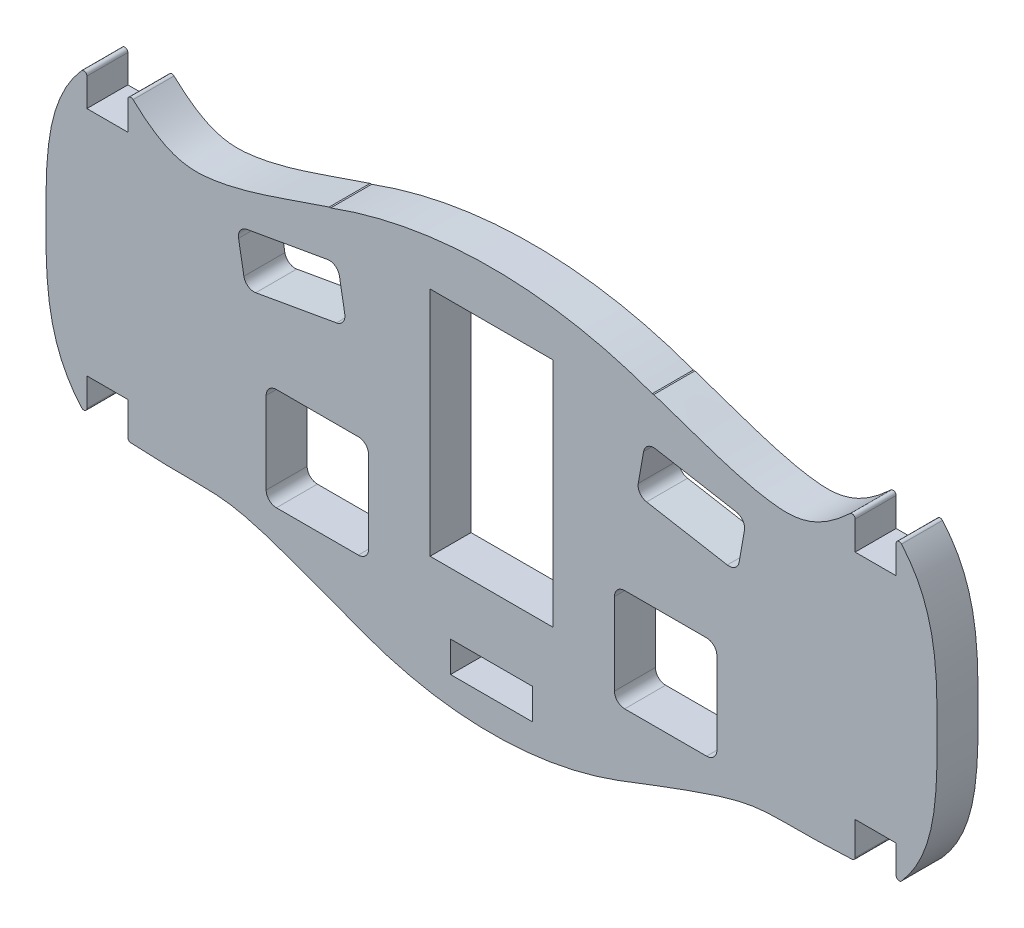
from build123d import *

# Parameters (mm, degrees)
ESTRUSIONE_ESTRUSIONE1_OUTLINE_W   = 10
ESTRUSIONE_ESTRUSIONE1_OUTLINE_H   = 10
ESTRUSIONE_ESTRUSIONE1_OUTLINE_W_2 = 8
ESTRUSIONE_ESTRUSIONE1_OUTLINE_H_2 = 3
ESTRUSIONE_ESTRUSIONE1_OUTLINE_W_3 = 12
ESTRUSIONE_ESTRUSIONE1_OUTLINE_H_3 = 22.6
ESTRUSIONE_ESTRUSIONE1_DEPTH       = 4
RACCORDO1_R                        = 1
RACCORDO3_R                        = 1
RACCORDO4_R                        = 0.3


# Read off the part's stored shape, not the designer's step: Estrusione-Estrusione1
with BuildPart() as part:
    # Estrusione-Estrusione1 outline → Estrusione-Estrusione1 (new body)
    with BuildSketch(Plane.XY):
        with BuildLine():
            add(Edge.make_bspline(
                [(39.5, 29.6), (43.506938427, 25.593061573), (43.493061573, 14.8), (43.506938427, 4.006938427), (39.5, 0)],
                knots=[0, 0, 0, 0, 0.5, 1, 1, 1, 1], degree=3))
            Line((39.5, 29.6), (39.5, 26.1))
            Line((39.5, 26.1), (35.5, 26.1))
            Line((35.5, 26.1), (35.5, 29.6))
            add(Edge.make_bspline(
                [(35.5, 29.6), (31.962623794, 26.062612753), (26.4060962, 25.659880805), (20.342579531, 28.112334068), (15.848598331, 29.600000017)],
                knots=[0, 0, 0, 0, 0.358970883, 0.890087037, 0.890087037, 0.890087037, 0.890087037], degree=3))
            Line((15.848598331, 29.600000017), (15.7, 29.6))
            ThreePointArc((15.7, 29.6), (0, 32.400991179), (-15.7, 29.6))
            Line((-15.7, 29.6), (-15.848598331, 29.600000017))
            add(Edge.make_bspline(
                [(-35.5, 29.6), (-31.962623794, 26.062612753), (-26.4060962, 25.659880805), (-20.342579531, 28.112334068), (-15.848598331, 29.600000017)],
                knots=[0, 0, 0, 0, 0.358970883, 0.890087037, 0.890087037, 0.890087037, 0.890087037], degree=3))
            Line((-35.5, 29.6), (-35.5, 26.1))
            Line((-35.5, 26.1), (-39.5, 26.1))
            Line((-39.5, 26.1), (-39.5, 29.6))
            add(Edge.make_bspline(
                [(-39.5, 29.6), (-43.506938427, 25.593061573), (-43.493061573, 14.8), (-43.506938427, 4.006938427), (-39.5, 0)],
                knots=[0, 0, 0, 0, 0.5, 1, 1, 1, 1], degree=3))
            Line((-39.5, 0), (-39.5, 3.5))
            Line((-39.5, 3.5), (-35.5, 3.5))
            Line((-35.5, 3.5), (-35.5, 0))
            add(Edge.make_bspline(
                [(-35.5, 0), (-24.124671667, -0.699725618), (-28.237292398, 1.331108434), (-12.322535381, -4.786451171)],
                knots=[0, 0, 0, 0, 1, 1, 1, 1], degree=3))
            ThreePointArc((-12.322535381, -4.786451171), (0, -6.987919299), (12.322535381, -4.786451171))
            add(Edge.make_bspline(
                [(35.5, 0), (24.124671667, -0.699725618), (28.237292398, 1.331108434), (12.322535381, -4.786451171)],
                knots=[0, 0, 0, 0, 1, 1, 1, 1], degree=3))
            Line((35.5, 0), (35.5, 3.5))
            Line((35.5, 3.5), (39.5, 3.5))
            Line((39.5, 3.5), (39.5, 0))
        make_face()
        with Locations((-17, 6.6)):
            Rectangle(ESTRUSIONE_ESTRUSIONE1_OUTLINE_W, ESTRUSIONE_ESTRUSIONE1_OUTLINE_H, mode=Mode.SUBTRACT)
        with Locations((0, -2.5)):
            Rectangle(ESTRUSIONE_ESTRUSIONE1_OUTLINE_W_2, ESTRUSIONE_ESTRUSIONE1_OUTLINE_H_2, mode=Mode.SUBTRACT)
        with Locations((17, 6.6)):
            Rectangle(ESTRUSIONE_ESTRUSIONE1_OUTLINE_W, ESTRUSIONE_ESTRUSIONE1_OUTLINE_H, mode=Mode.SUBTRACT)
        Polygon((-24.868240888, 23.524038765), (-15.020163358, 25.260520542), (-14.15192247, 20.336481777), (-24, 18.6), align=None, mode=Mode.SUBTRACT)
        with Locations((0, 16.3)):
            Rectangle(ESTRUSIONE_ESTRUSIONE1_OUTLINE_W_3, ESTRUSIONE_ESTRUSIONE1_OUTLINE_H_3, mode=Mode.SUBTRACT)
        Polygon((15.020163358, 25.260520542), (24.868240888, 23.524038765), (24, 18.6), (14.15192247, 20.336481777), align=None, mode=Mode.SUBTRACT)
    extrude(amount=ESTRUSIONE_ESTRUSIONE1_DEPTH)

    # Raccordo1
    raccordo1_edges = [part.edges().sort_by_distance(p)[0] for p in [
        (15.020163358, 25.260520542, 2),
        (14.15192247, 20.336481777, 2),
        (24, 18.6, 2),
        (24.868240888, 23.524038765, 2),
        (-24.868240888, 23.524038765, 2),
        (-24, 18.6, 2),
        (-14.15192247, 20.336481777, 2),
        (-15.020163358, 25.260520542, 2),
    ]]
    fillet(raccordo1_edges, radius=RACCORDO1_R)

    # Raccordo3
    raccordo3_edges = [part.edges().sort_by_distance(p)[0] for p in [
        (12, 11.6, 2),
        (12, 1.6, 2),
        (22, 1.6, 2),
        (22, 11.6, 2),
        (-22, 11.6, 2),
        (-22, 1.6, 2),
        (-12, 1.6, 2),
        (-12, 11.6, 2),
    ]]
    fillet(raccordo3_edges, radius=RACCORDO3_R)

    # Raccordo4
    raccordo4_edges = [part.edges().sort_by_distance(p)[0] for p in [
        (-35.5, 0, 2),
        (-39.5, 0, 2),
        (35.5, 0, 2),
        (39.5, 0, 2),
        (39.5, 29.6, 2),
        (35.5, 29.6, 2),
        (-39.5, 29.6, 2),
        (-35.5, 29.6, 2),
    ]]
    fillet(raccordo4_edges, radius=RACCORDO4_R)


solid = part.part
